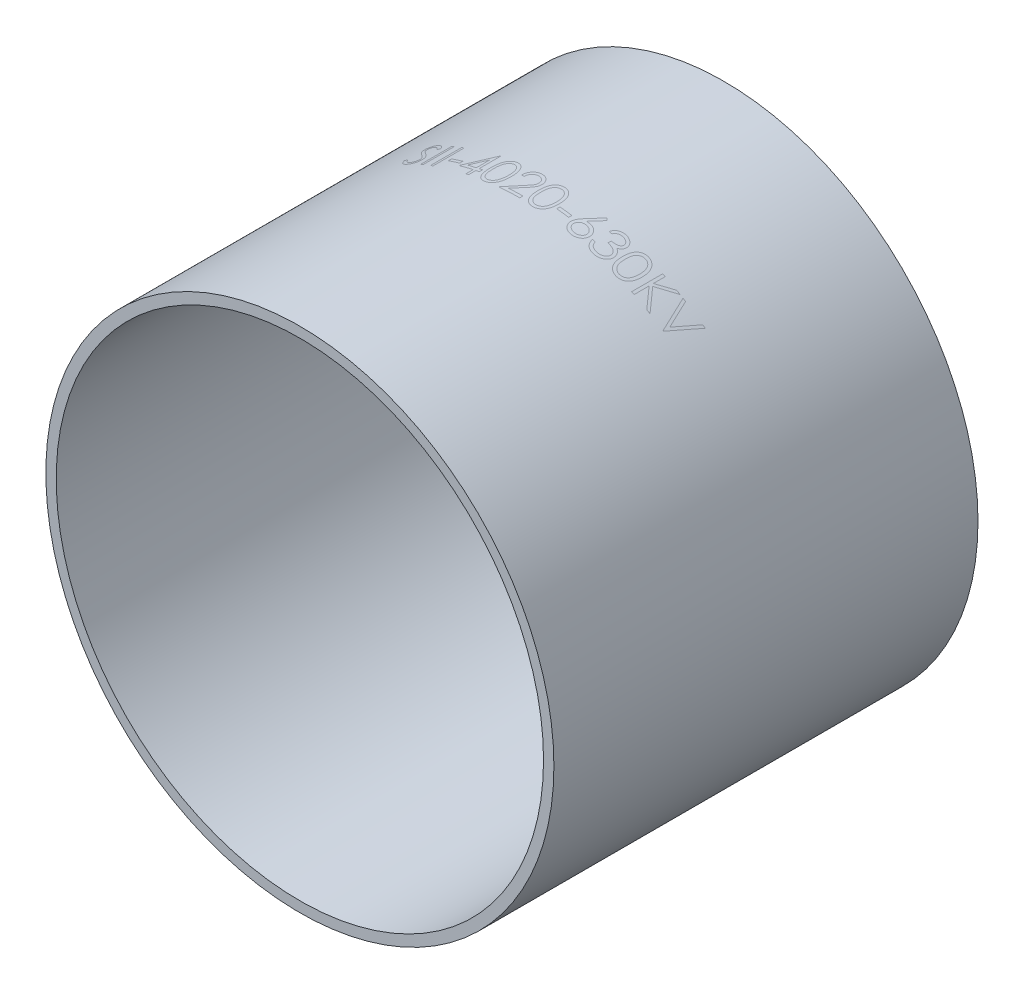
from build123d import *

# Parameters (mm, degrees)
ESBO_O1_R                = 24.5
ESBO_O1_R_2              = 23.5
RESSALTO_EXTRUS_O1_DEPTH = 40.9


with BuildPart() as part:
    # Esboço1 → Ressalto-extrusão1 (new body)
    with BuildSketch(Plane.XY):
        Circle(ESBO_O1_R)
        Circle(ESBO_O1_R_2, mode=Mode.SUBTRACT)
    extrude(amount=RESSALTO_EXTRUS_O1_DEPTH)


solid = part.part
